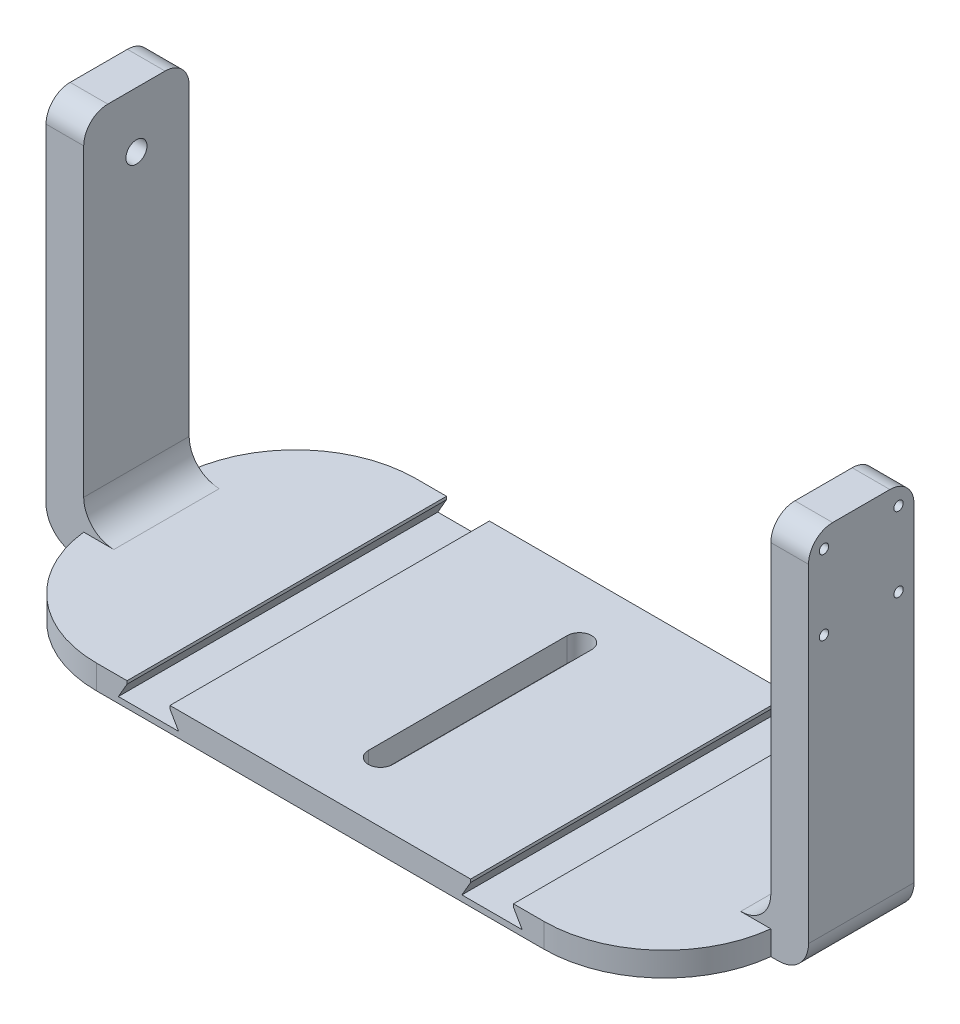
from build123d import *

# Parameters (mm, degrees)
SKETCH1_W           = 12.5
SKETCH1_H           = 127
BOSS_EXTRUDE1_DEPTH = 106
SKETCH2_W           = 12.5
SKETCH2_H           = 35.5
CUT_EXTRUDE1_DEPTH  = 200
FILLET3_R           = 8
FILLET4_R           = 10
FILLET5_R           = 40
SKETCH5_R           = 3.5
CUT_EXTRUDE5_DEPTH  = 25
CUT_EXTRUDE6_START  = -6
SKETCH5_3_R         = 9.5
SKETCH5_3_R_2       = 3.5
CUT_EXTRUDE6_DEPTH  = 7
SKETCH4_R           = 1.55
CUT_EXTRUDE7_DEPTH  = 16


with BuildPart() as part:
    # Sketch1 → Boss-Extrude1 (new body)
    with BuildSketch(Plane.XY):
        Polygon((0, 8), (0, 0), (228, 0), (228, 8), (178.113248654, 8), (178.113248654, 7), (181, 2), (161, 2), (163.886751346, 7), (163.886751346, 8), (64.113248654, 8), (64.113248654, 7), (67, 2), (47, 2), (49.886751346, 7), (49.886751346, 8), align=None)
        with Locations((234.25, 63.5)):
            Rectangle(SKETCH1_W, SKETCH1_H)
        with Locations((-6.25, 63.5)):
            Rectangle(SKETCH1_W, SKETCH1_H)
    extrude(amount=-BOSS_EXTRUDE1_DEPTH)

    # Sketch2 → Cut-Extrude1 (cut)
    with BuildSketch(Plane(origin=(0, 127, 0), x_dir=(1, 0, 0), z_dir=(0, 1, 0))):
        with Locations((-6.25, 88.25)):
            Rectangle(SKETCH2_W, SKETCH2_H)
        with Locations((-6.25, 17.75)):
            Rectangle(SKETCH2_W, SKETCH2_H)
        with Locations((234.25, 88.25)):
            Rectangle(SKETCH2_W, SKETCH2_H)
        with Locations((234.25, 17.75)):
            Rectangle(SKETCH2_W, SKETCH2_H)
        with BuildLine():
            Line((109.95, 20), (109.95, 86))
            ThreePointArc((109.95, 86), (114, 90.05), (118.05, 86))
            Line((118.05, 86), (118.05, 20))
            ThreePointArc((118.05, 20), (114, 15.95), (109.95, 20))
        make_face()
    extrude(amount=-CUT_EXTRUDE1_DEPTH, mode=Mode.SUBTRACT)

    # Fillet3
    fillet3_edges = [part.edges().sort_by_distance(p)[0] for p in [
        (-6.25, 127, -35.5),
        (234.25, 127, -70.5),
        (234.25, 127, -35.5),
        (-6.25, 127, -70.5),
    ]]
    fillet(fillet3_edges, radius=FILLET3_R)

    # Fillet4
    fillet4_edges = [part.edges().sort_by_distance(p)[0] for p in [
        (228, 8, -53),
        (240.5, 0, -53),
        (0, 8, -53),
        (-12.5, 0, -53),
    ]]
    fillet(fillet4_edges, radius=FILLET4_R)

    # Fillet5
    # the kernel refuses this fillet: 40 mm, written as the material it takes off along each edge
    with BuildSketch(Plane(origin=(228, 107.36517247, -106), x_dir=(-1, 0, 0), z_dir=(0, -1, 0))) as fillet5_piece_1:
        with BuildLine():
            CenterArc((39.746068988, -40), FILLET5_R, 90, 83.540550223)
            Line((0, -35.5), (-0.79492138, -35.41))
            ThreePointArc((-0.79492138, -35.41), (-0.8, -17.75), (-0.8, 0))
            Line((-0.8, 0), (0, 0.8))
            Line((0, 0.8), (39.746068988, 0.8))
            Line((39.746068988, 0.8), (39.746068988, 0))
        make_face()
    extrude(amount=206.73034494, mode=Mode.SUBTRACT)
    with BuildSketch(Plane(origin=(0, 107.36517247, -106), x_dir=(0, 0, 1), z_dir=(0, -1, 0))) as fillet5_piece_2:
        with BuildLine():
            CenterArc((40, -39.746068988), FILLET5_R, 96.459449777, 83.540550223)
            Line((0, -39.746068988), (-0.8, -39.746068988))
            Line((-0.8, -39.746068988), (-0.8, 0))
            Line((-0.8, 0), (0, 0.8))
            ThreePointArc((0, 0.8), (17.75, 0.8), (35.41, 0.79492138))
            Line((35.41, 0.79492138), (35.5, 0))
        make_face()
    extrude(amount=206.73034494, mode=Mode.SUBTRACT)
    with BuildSketch(Plane(origin=(0, 107.36517247, 0), x_dir=(0, 0, -1), z_dir=(0, -1, 0))) as fillet5_piece_3:
        with BuildLine():
            CenterArc((40, 39.746068988), FILLET5_R, 180, 83.540550223)
            Line((0, 39.746068988), (-0.8, 39.746068988))
            Line((-0.8, 39.746068988), (-0.8, 0))
            Line((-0.8, 0), (0, -0.8))
            ThreePointArc((0, -0.8), (17.75, -0.8), (35.41, -0.79492138))
            Line((35.41, -0.79492138), (35.5, 0))
        make_face()
    extrude(amount=206.73034494, mode=Mode.SUBTRACT)
    with BuildSketch(Plane(origin=(228, 107.36517247, 0), x_dir=(-1, 0, 0), z_dir=(0, -1, 0))) as fillet5_piece_4:
        with BuildLine():
            CenterArc((39.746068988, 40), FILLET5_R, 186.459449777, 83.540550223)
            Line((0, 35.5), (-0.79492138, 35.41))
            ThreePointArc((-0.79492138, 35.41), (-0.8, 17.75), (-0.8, 0))
            Line((-0.8, 0), (0, -0.8))
            Line((0, -0.8), (39.746068988, -0.8))
            Line((39.746068988, -0.8), (39.746068988, 0))
        make_face()
    extrude(amount=206.73034494, mode=Mode.SUBTRACT)

    # Sketch5 → Cut-Extrude5 (cut)
    with BuildSketch(Plane(origin=(0, 0, 0), x_dir=(0, 0, -1), z_dir=(1, 0, 0))):
        with Locations((53, 108.5)):
            Circle(SKETCH5_R)
    extrude(amount=-CUT_EXTRUDE5_DEPTH, mode=Mode.SUBTRACT)

    # Sketch5<3> → Cut-Extrude6 (cut)
    with BuildSketch(Plane(origin=(0, 0, 0), x_dir=(0, 0, -1), z_dir=(1, 0, 0)).offset(CUT_EXTRUDE6_START)):
        with Locations((53, 108.5)):
            Circle(SKETCH5_3_R)
        with Locations((53, 108.5)):
            Circle(SKETCH5_3_R_2, mode=Mode.SUBTRACT)
    extrude(amount=-CUT_EXTRUDE6_DEPTH, mode=Mode.SUBTRACT)

    # Sketch4 → Cut-Extrude7 (cut)
    with BuildSketch(Plane(origin=(240.5, 0, 0), x_dir=(0, 0, -1), z_dir=(1, 0, 0))):
        with Locations((40.625, 120.875)):
            Circle(SKETCH4_R)
        with Locations((40.625, 96.125)):
            Circle(SKETCH4_R)
        with Locations((65.375, 96.125)):
            Circle(SKETCH4_R)
        with Locations((65.375, 120.875)):
            Circle(SKETCH4_R)
    extrude(amount=-CUT_EXTRUDE7_DEPTH, mode=Mode.SUBTRACT)


solid = part.part
